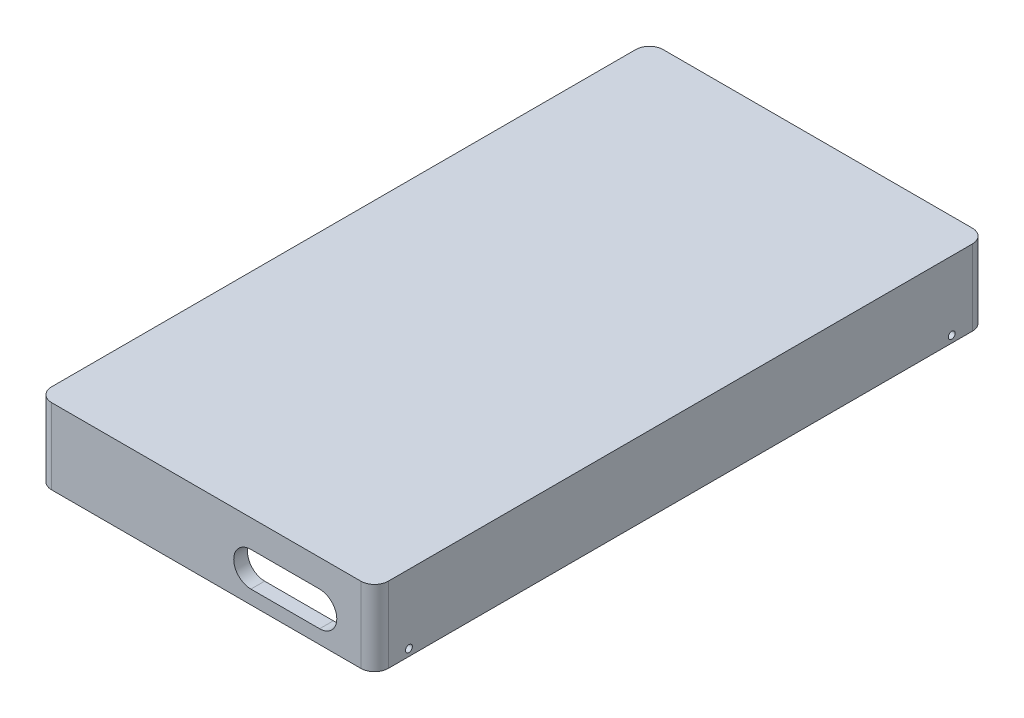
from build123d import *

# Parameters (mm, degrees)
SKETCH1_W           = 57.15
SKETCH1_H           = 107.95
BOSS_EXTRUDE1_DEPTH = 2.54
SKETCH2_W           = 62.23
SKETCH2_H           = 113.03
SKETCH2_W_2         = 57.15
SKETCH2_H_2         = 107.95
BOSS_EXTRUDE3_DEPTH = 13.97
CUT_EXTRUDE1_DEPTH  = 10.16
FILLET1_R           = 2.54
SKETCH4_R           = 0.635
CUT_EXTRUDE2_DEPTH  = 128.323438141


with BuildPart() as part:
    # Sketch1 → Boss-Extrude1 (new body)
    with BuildSketch(Plane(origin=(0, 0, 0), x_dir=(1, 0, 0), z_dir=(0, 1, 0))):
        with Locations((28.575, 53.975)):
            Rectangle(SKETCH1_W, SKETCH1_H)
    extrude(amount=BOSS_EXTRUDE1_DEPTH)

    # Sketch2 → Boss-Extrude3 (add)
    with BuildSketch(Plane(origin=(0, 2.54, 0), x_dir=(1, 0, 0), z_dir=(0, 1, 0))):
        with Locations((28.575, 53.975)):
            Rectangle(SKETCH2_W, SKETCH2_H)
        with Locations((28.575, 53.975)):
            Rectangle(SKETCH2_W_2, SKETCH2_H_2, mode=Mode.SUBTRACT)
    extrude(amount=-BOSS_EXTRUDE3_DEPTH)

    # Sketch3 → Cut-Extrude1 (cut)
    with BuildSketch(Plane.XY.offset(2.54)):
        with BuildLine():
            Line((36.83, -2.54), (49.53, -2.54))
            ThreePointArc((49.53, -2.54), (52.705, -5.715), (49.53, -8.89))
            Line((49.53, -8.89), (36.83, -8.89))
            ThreePointArc((36.83, -8.89), (33.655, -5.715), (36.83, -2.54))
        make_face()
    extrude(amount=-CUT_EXTRUDE1_DEPTH, mode=Mode.SUBTRACT)

    # Fillet1
    fillet1_edges = [part.edges().sort_by_distance(p)[0] for p in [
        (-2.54, -4.445, -110.49),
        (59.69, -4.445, -110.49),
        (59.69, -4.445, 2.54),
        (-2.54, -4.445, 2.54),
    ]]
    fillet(fillet1_edges, radius=FILLET1_R)

    # Sketch4 → Cut-Extrude2 (cut, through all)
    with BuildSketch(Plane.ZY.offset(2.54)):
        with Locations((-104.14, -10.16)):
            Circle(SKETCH4_R)
        with Locations((-3.81, -10.16)):
            Circle(SKETCH4_R)
    extrude(amount=-CUT_EXTRUDE2_DEPTH, mode=Mode.SUBTRACT)


solid = part.part
